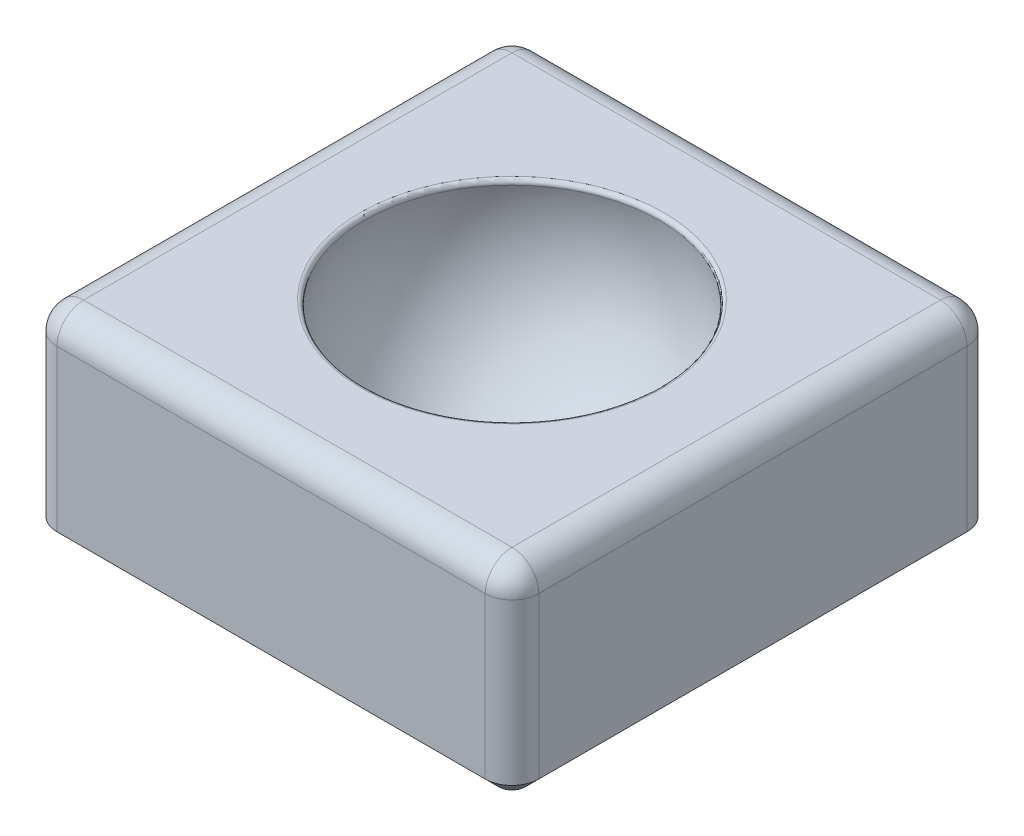
from build123d import *

# Parameters (mm, degrees)
SKETCH_1_W          = 36
SKETCH_1_H          = 36
EXTRUDE_1_DEPTH     = 15
FILLET_1_R          = 0.3
FILLET_2_R          = 2
SKETCH_5_R          = 3
CUT_EXTRUDE_1_DEPTH = 10
CHAMFER_1_SIZE      = 1


with BuildPart() as part:
    # Эскиз1 → Бобышка-Вытянуть1 (new body)
    with BuildSketch(Plane(origin=(0, 0, 0), x_dir=(1, 0, 0), z_dir=(0, 1, 0))):
        Rectangle(SKETCH_1_W, SKETCH_1_H)
    extrude(amount=EXTRUDE_1_DEPTH)

    # Эскиз4 → Вырез-Повернуть2 (revolve, cut)
    with BuildSketch(Plane(origin=(0, 12, 0), x_dir=(1, 0, 0), z_dir=(0, 1, 0))):
        with BuildLine():
            Line((-11.35, 0), (11.35, 0))
            ThreePointArc((11.35, 0), (0, 11.35), (-11.35, 0))
        make_face()
    revolve(axis=Axis((-23.513868144, 12, 0), (1, 0, 0)), mode=Mode.SUBTRACT)

    # Скругление1
    fillet_1_edges = [part.edges().sort_by_distance(p)[0] for p in [
        (0, 15, -10.946346422),
    ]]
    fillet(fillet_1_edges, radius=FILLET_1_R)

    # Скругление2
    fillet_2_edges = [part.edges().sort_by_distance(p)[0] for p in [
        (0, 15, -18),
        (18, 15, 0),
        (0, 15, 18),
        (-18, 15, 0),
        (-18, 7.5, -18),
        (-18, 7.5, 18),
        (18, 7.5, -18),
        (18, 7.5, 18),
    ]]
    fillet(fillet_2_edges, radius=FILLET_2_R)

    # Эскиз5 → Вырез-Вытянуть1 (cut)
    with BuildSketch(Plane.XZ):
        Circle(SKETCH_5_R)
    extrude(amount=-CUT_EXTRUDE_1_DEPTH, mode=Mode.SUBTRACT)

    # Фаска1
    chamfer_1_edges = [part.edges().sort_by_distance(p)[0] for p in [
        (-17.414213562, 0, 17.414213562),
        (0, 0, 18),
        (17.414213562, 0, 17.414213562),
        (18, 0, 0),
        (17.414213562, 0, -17.414213562),
        (0, 0, -18),
        (-17.414213562, 0, -17.414213562),
        (-18, 0, 0),
        (-3, 0, 0),
    ]]
    chamfer(chamfer_1_edges, length=CHAMFER_1_SIZE)


solid = part.part
